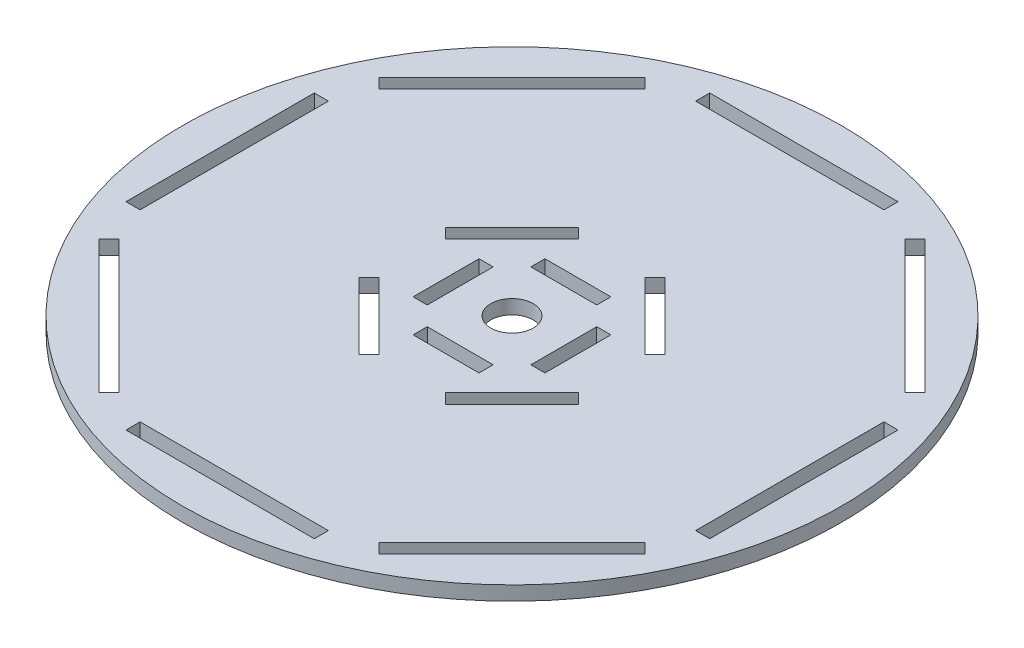
from build123d import *

# Parameters (mm, degrees)
CROQUIS1_R              = 70
CROQUIS1_R_2            = 4.5
SALIENTE_EXTRUIR1_DEPTH = 3


with BuildPart() as part:
    # Croquis1 → Saliente-Extruir1 (new body)
    with BuildSketch(Plane(origin=(0, 0, 0), x_dir=(1, 0, 0), z_dir=(0, 1, 0))):
        Circle(CROQUIS1_R)
        Circle(CROQUIS1_R_2, mode=Mode.SUBTRACT)
        Polygon((0, 11), (7, 11), (7, 14), (-7, 14), (-7, 11), align=None, mode=Mode.SUBTRACT)
        Polygon((11, 0), (11, 7), (14, 7), (14, -7), (11, -7), align=None, mode=Mode.SUBTRACT)
        Polygon((-14.142135624, 14.142135624), (-7.071067812, 21.213203436), (-9.192388155, 23.334523779), (-23.334523779, 9.192388155), (-21.213203436, 7.071067812), align=None, mode=Mode.SUBTRACT)
        Polygon((-14, -7), (-11, -7), (-11, 0), (-11, 7), (-14, 7), align=None, mode=Mode.SUBTRACT)
        Polygon((7, -11), (7, -14), (-7, -14), (-7, -11), (0, -11), align=None, mode=Mode.SUBTRACT)
        Polygon((23.334523779, 9.192388155), (9.192388155, 23.334523779), (7.071067812, 21.213203436), (14.142135624, 14.142135624), (21.213203436, 7.071067812), align=None, mode=Mode.SUBTRACT)
        Polygon((9.192388155, -23.334523779), (23.334523779, -9.192388155), (21.213203436, -7.071067812), (14.142135624, -14.142135624), (7.071067812, -21.213203436), align=None, mode=Mode.SUBTRACT)
        Polygon((-23.334523779, -9.192388155), (-9.192388155, -23.334523779), (-7.071067812, -21.213203436), (-14.142135624, -14.142135624), (-21.213203436, -7.071067812), align=None, mode=Mode.SUBTRACT)
        Polygon((0, 62), (20, 62), (20, 59), (-20, 59), (-20, 62), align=None, mode=Mode.SUBTRACT)
        Polygon((55.861435714, 27.577164466), (27.577164466, 55.861435714), (29.69848481, 57.982756057), (43.840620434, 43.840620434), (57.982756057, 29.69848481), align=None, mode=Mode.SUBTRACT)
        Polygon((59, -20), (59, 20), (62, 20), (62, 0), (62, -20), align=None, mode=Mode.SUBTRACT)
        Polygon((27.577164466, -55.861435714), (55.861435714, -27.577164466), (57.982756057, -29.69848481), (43.840620434, -43.840620434), (29.69848481, -57.982756057), align=None, mode=Mode.SUBTRACT)
        Polygon((-20, -59), (20, -59), (20, -62), (0, -62), (-20, -62), align=None, mode=Mode.SUBTRACT)
        Polygon((-55.861435714, -27.577164466), (-27.577164466, -55.861435714), (-29.69848481, -57.982756057), (-43.840620434, -43.840620434), (-57.982756057, -29.69848481), align=None, mode=Mode.SUBTRACT)
        Polygon((-59, 20), (-59, -20), (-62, -20), (-62, 0), (-62, 20), align=None, mode=Mode.SUBTRACT)
        Polygon((-27.577164466, 55.861435714), (-55.861435714, 27.577164466), (-57.982756057, 29.69848481), (-43.840620434, 43.840620434), (-29.69848481, 57.982756057), align=None, mode=Mode.SUBTRACT)
    extrude(amount=SALIENTE_EXTRUIR1_DEPTH)


solid = part.part
